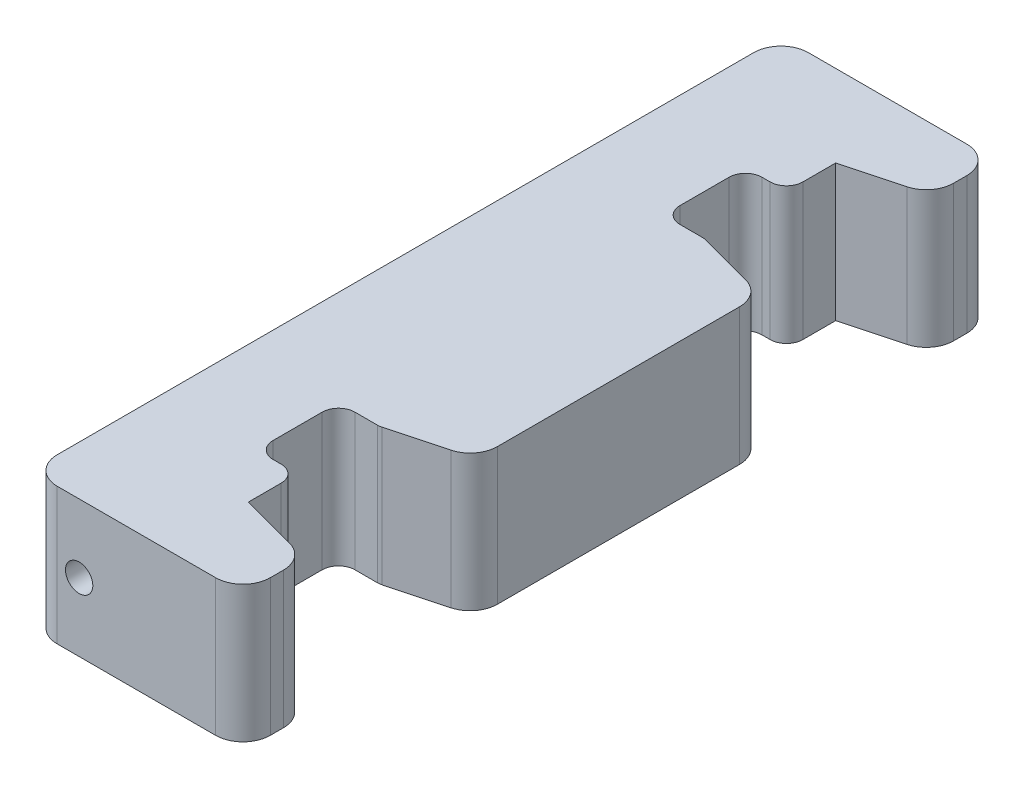
from build123d import *

# Parameters (mm, degrees)
BOSS_EXTRUDE1_DEPTH = 12.7
CUT_EXTRUDE1_DEPTH  = 40.701467542
FILLET4_R           = 1.524
FILLET5_R           = 2.54
SKETCH3_R           = 1.27
CUT_EXTRUDE2_DEPTH  = 73.356571229


with BuildPart() as part:
    # Sketch1 → Boss-Extrude1 (new body)
    with BuildSketch(Plane(origin=(0, 0, 0), x_dir=(1, 0, 0), z_dir=(0, 1, 0))):
        Polygon((5.842, 34.925), (-13.97, 34.925), (-13.97, -34.925), (5.842, -34.925), (5.842, -27.305), (-1.27, -27.305), (-1.27, -22.733), (-5.08, -22.733), (-5.08, -15.113), (-1.27, -15.113), (5.842, -15.113), (5.842, 15.113), (-1.27, 15.113), (-5.08, 15.113), (-5.08, 22.733), (-1.27, 22.733), (-1.27, 27.305), (5.842, 27.305), align=None)
    extrude(amount=BOSS_EXTRUDE1_DEPTH)

    # Sketch2 → Cut-Extrude1 (cut, through all)
    with BuildSketch(Plane(origin=(0, 12.7, 0), x_dir=(1, 0, 0), z_dir=(0, 1, 0))):
        Polygon((-1.27, 27.305), (5.842, 29.210654657), (5.842, 27.305), align=None)
        Polygon((-1.27, -27.305), (5.842, -29.210654657), (5.842, -27.305), align=None)
        Polygon((-1.27, -15.113), (5.842, -13.207345343), (5.842, -15.113), align=None)
        Polygon((-1.27, 15.113), (5.842, 13.207345343), (5.842, 15.113), align=None)
    extrude(amount=-CUT_EXTRUDE1_DEPTH, mode=Mode.SUBTRACT)

    # Fillet4
    fillet4_edges = [part.edges().sort_by_distance(p)[0] for p in [
        (-1.27, 6.35, -15.113),
        (-1.27, 6.35, 15.113),
        (-1.27, 6.35, 22.733),
        (-5.08, 6.35, 22.733),
        (-5.08, 6.35, 15.113),
        (-5.08, 6.35, -15.113),
        (-5.08, 6.35, -22.733),
        (-1.27, 6.35, -22.733),
    ]]
    fillet(fillet4_edges, radius=FILLET4_R)

    # Fillet5
    fillet5_edges = [part.edges().sort_by_distance(p)[0] for p in [
        (-13.97, 6.35, 34.925),
        (-13.97, 6.35, -34.925),
        (5.842, 6.35, -34.925),
        (5.842, 6.35, -29.210654657),
        (5.842, 6.35, -13.207345343),
        (5.842, 6.35, 13.207345343),
        (5.842, 6.35, 34.925),
        (5.842, 6.35, 29.210654657),
    ]]
    fillet(fillet5_edges, radius=FILLET5_R)

    # Sketch3 → Cut-Extrude2 (cut, through all)
    with BuildSketch(Plane.XY.offset(34.925)):
        with Locations((-9.391956596, 6.35)):
            Circle(SKETCH3_R)
    extrude(amount=-CUT_EXTRUDE2_DEPTH, mode=Mode.SUBTRACT)


solid = part.part
